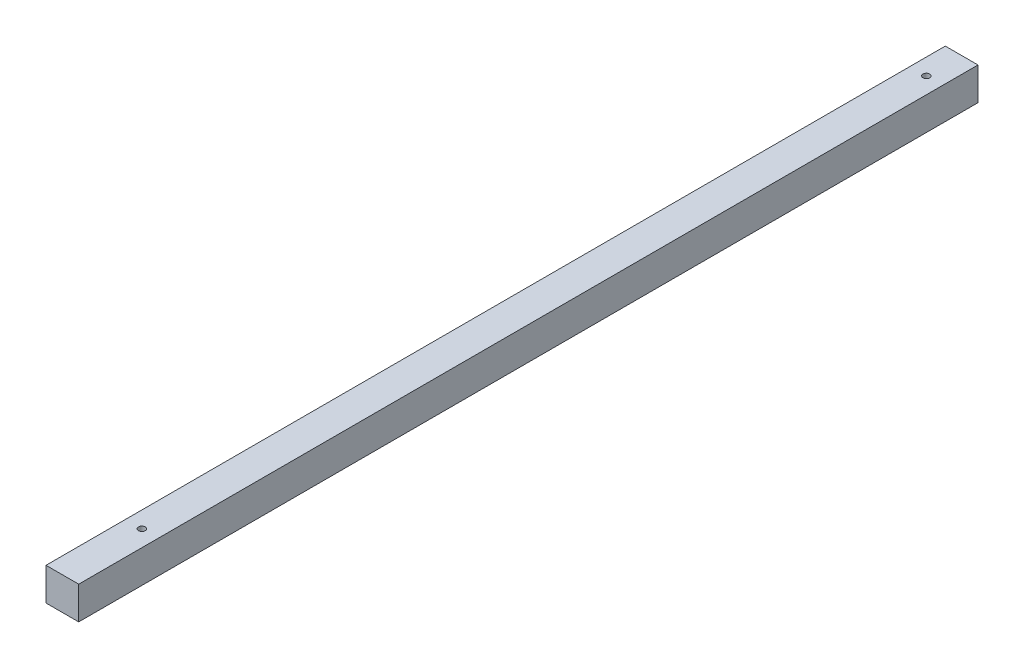
from build123d import *

# Parameters (mm, degrees)
ESQUISSE1_W             = 10
ESQUISSE1_H             = 10
BOSS_EXTRU_1_DEPTH      = 275
ESQUISSE2_R             = 1.025
ENL_V_MAT_EXTRU_1_DEPTH = 276.36339626
ESQUISSE3_R             = 1.025
ENL_V_MAT_EXTRU_2_DEPTH = 276.36339626


with BuildPart() as part:
    # Esquisse1 → Boss.-Extru.1 (new body)
    with BuildSketch(Plane.XY):
        with Locations((5, 5)):
            Rectangle(ESQUISSE1_W, ESQUISSE1_H)
    extrude(amount=BOSS_EXTRU_1_DEPTH)

    # Esquisse2 → Enlèv. mat.-Extru.1 (cut, through all)
    with BuildSketch(Plane(origin=(0, 10, 0), x_dir=(1, 0, 0), z_dir=(0, 1, 0))):
        with Locations((5, -10.81)):
            Circle(ESQUISSE2_R)
    extrude(amount=-ENL_V_MAT_EXTRU_1_DEPTH, mode=Mode.SUBTRACT)

    # Esquisse3 → Enlèv. mat.-Extru.2 (cut, through all)
    with BuildSketch(Plane(origin=(0, 10, 0), x_dir=(1, 0, 0), z_dir=(0, 1, 0))):
        with Locations((5, -250.68)):
            Circle(ESQUISSE3_R)
    extrude(amount=-ENL_V_MAT_EXTRU_2_DEPTH, mode=Mode.SUBTRACT)


solid = part.part
